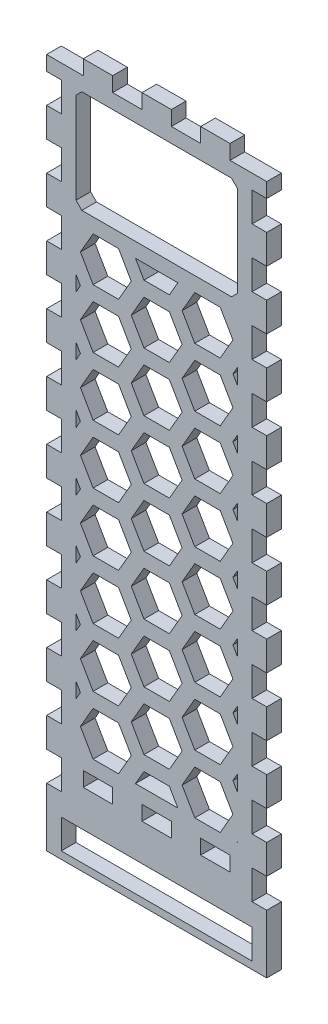
from build123d import *

# Parameters (mm, degrees)
SKETCH1_W           = 95.25
SKETCH1_H           = 304.8
BOSS_EXTRUDE1_DEPTH = 6.35
SKETCH2_W           = 6.35
SKETCH2_H           = 12.7
CUT_EXTRUDE1_DEPTH  = 320.399319035
LPATTERN1_COUNT     = 12
LPATTERN1_PITCH     = 25.4
SKETCH3_W           = 15.875
SKETCH3_H           = 6.35
SKETCH3_W_2         = 12.7
CUT_EXTRUDE2_DEPTH  = 320.399319035
SKETCH4_W           = 12.7
SKETCH4_H           = 6.35
CUT_EXTRUDE3_DEPTH  = 320.399319035
SKETCH7_W           = 6.35
SKETCH7_H           = 12.7
BOSS_EXTRUDE2_DEPTH = 6.35
SKETCH5_W           = 82.55
SKETCH5_H           = 12.7
CUT_EXTRUDE4_DEPTH  = 320.399319035
SKETCH8_W           = 69.85
SKETCH8_H           = 247.65
BOSS_EXTRUDE3_DEPTH = 6.35
CUT_EXTRUDE6_DEPTH  = 320.399319035
FILL_PATTERN1_DEPTH = 6.35
SKETCH8_2_W         = 69.85
SKETCH8_2_H         = 247.65
CUT_EXTRUDE7_DEPTH  = 320.399319035
SKETCH10_W          = 69.85
SKETCH10_H          = 6.35
BOSS_EXTRUDE4_DEPTH = 6.35
SKETCH11_W          = 69.85
SKETCH11_H          = 44.45
CUT_EXTRUDE8_DEPTH  = 320.399319035
CHAMFER1_SIZE       = 2.54


# Read off the part's stored shape, not the designer's step: Fill Pattern1
with BuildPart() as part:
    # Sketch1 → Boss-Extrude1 (new body)
    with BuildSketch(Plane.XY):
        with Locations((47.625, 152.4)):
            Rectangle(SKETCH1_W, SKETCH1_H)
    extrude(amount=BOSS_EXTRUDE1_DEPTH)

    # Sketch2 → Cut-Extrude1 (cut, through all)
    with BuildSketch(Plane.XY.offset(6.35)):
        with Locations((3.175, 6.35)):
            Rectangle(SKETCH2_W, SKETCH2_H)
        with Locations((92.075, 6.35)):
            Rectangle(SKETCH2_W, SKETCH2_H)
    cut_extrude1 = extrude(amount=-CUT_EXTRUDE1_DEPTH, mode=Mode.SUBTRACT)

    # LPattern1: Cut-Extrude1 ×12
    with Locations(*[(0, i * LPATTERN1_PITCH, 0) for i in range(1, LPATTERN1_COUNT)]):
        add(cut_extrude1, mode=Mode.SUBTRACT)

    # Sketch3 → Cut-Extrude2 (cut, through all)
    with BuildSketch(Plane.XY.offset(6.35)):
        with Locations((7.9375, 301.625)):
            Rectangle(SKETCH3_W, SKETCH3_H)
        with Locations((34.925, 301.625)):
            Rectangle(SKETCH3_W_2, SKETCH3_H)
        with Locations((60.325, 301.625)):
            Rectangle(SKETCH3_W_2, SKETCH3_H)
        with Locations((87.3125, 301.625)):
            Rectangle(SKETCH3_W, SKETCH3_H)
    extrude(amount=-CUT_EXTRUDE2_DEPTH, mode=Mode.SUBTRACT)

    # Sketch4 → Cut-Extrude3 (cut, through all)
    with BuildSketch(Plane.XY.offset(6.35)):
        with Locations((22.225, 34.925)):
            Rectangle(SKETCH4_W, SKETCH4_H)
        with Locations((47.625, 34.925)):
            Rectangle(SKETCH4_W, SKETCH4_H)
        with Locations((73.025, 34.925)):
            Rectangle(SKETCH4_W, SKETCH4_H)
    extrude(amount=-CUT_EXTRUDE3_DEPTH, mode=Mode.SUBTRACT)

    # Sketch7 → Boss-Extrude2 (add, through all)
    with BuildSketch(Plane.XY.offset(6.35)):
        with Locations((3.175, 6.35)):
            Rectangle(SKETCH7_W, SKETCH7_H)
        with Locations((92.075, 6.35)):
            Rectangle(SKETCH7_W, SKETCH7_H)
    extrude(amount=-BOSS_EXTRUDE2_DEPTH)

    # Sketch5 → Cut-Extrude4 (cut, through all)
    with BuildSketch(Plane.XY.offset(6.35)):
        with Locations((47.625, 9.525)):
            Rectangle(SKETCH5_W, SKETCH5_H)
    extrude(amount=-CUT_EXTRUDE4_DEPTH, mode=Mode.SUBTRACT)

    # Sketch8<2> → Cut-Extrude7 (cut, through all)
    with BuildSketch(Plane.XY.offset(6.35)):
        with Locations((47.625, 168.275)):
            Rectangle(SKETCH8_2_W, SKETCH8_2_H)
    extrude(amount=-CUT_EXTRUDE7_DEPTH, mode=Mode.SUBTRACT)


with BuildPart() as body_2:
    # Sketch8 → Boss-Extrude3 (new body)
    with BuildSketch(Plane.XY.offset(6.35)):
        with Locations((47.625, 168.275)):
            Rectangle(SKETCH8_W, SKETCH8_H)
    extrude(amount=-BOSS_EXTRUDE3_DEPTH)

    # Sketch9 → Cut-Extrude6 (cut, through all)
    with BuildSketch(Plane(origin=(0, 0, 0), x_dir=(-1, 0, 0), z_dir=(0, 0, -1))):
        Polygon((-42.125738686, 279.4), (-53.124261314, 279.4), (-58.623522628, 269.875), (-53.124261314, 260.35), (-42.125738686, 260.35), (-36.626477372, 269.875), align=None)
    extrude(amount=-CUT_EXTRUDE6_DEPTH, mode=Mode.SUBTRACT)

    # Fill Pattern1 outline → Fill Pattern1 (cut)
    with BuildSketch(Plane.XY):
        Polygon((31.127216058, 241.3), (20.12869343, 241.3), (14.629432116, 231.775), (20.12869343, 222.25), (31.127216058, 222.25), (36.626477372, 231.775), align=None)
        Polygon((64.122783942, 241.3), (58.623522628, 231.775), (64.122783942, 222.25), (75.12130657, 222.25), (80.620567884, 231.775), (75.12130657, 241.3), align=None)
        Polygon((82.55, 197.016874454), (80.620567884, 193.675), (82.55, 190.333125546), align=None)
        Polygon((82.55, 164.933125546), (82.55, 171.616874454), (80.620567884, 168.275), align=None)
        Polygon((80.620567884, 219.075), (82.55, 215.733125546), (82.55, 222.416874454), align=None)
        Polygon((82.55, 139.533125546), (82.55, 146.216874454), (80.620567884, 142.875), align=None)
        Polygon((80.620567884, 244.475), (82.55, 241.133125546), (82.55, 247.816874454), align=None)
        Polygon((82.55, 114.133125546), (82.55, 120.816874454), (80.620567884, 117.475), align=None)
        Polygon((80.620567884, 269.875), (82.55, 266.533125546), (82.55, 273.216874454), align=None)
        Polygon((82.55, 88.733125546), (82.55, 95.416874454), (80.620567884, 92.075), align=None)
        Polygon((82.453654989, 292.1), (82.55, 291.933125546), (82.55, 292.1), align=None)
        Polygon((82.55, 63.333125546), (82.55, 70.016874454), (80.620567884, 66.675), align=None)
        Polygon((80.620567884, 282.575), (75.12130657, 292.1), (64.122783942, 292.1), (58.623522628, 282.575), (64.122783942, 273.05), (75.12130657, 273.05), align=None)
        Polygon((82.55, 44.45), (82.55, 44.616874454), (82.453654989, 44.45), align=None)
        Polygon((53.124261314, 285.75), (56.790435523, 292.1), (38.459564477, 292.1), (42.125738686, 285.75), align=None)
        Polygon((64.122783942, 44.45), (75.12130657, 44.45), (80.620567884, 53.975), (75.12130657, 63.5), (64.122783942, 63.5), (58.623522628, 53.975), align=None)
        Polygon((36.626477372, 282.575), (31.127216058, 292.1), (20.12869343, 292.1), (14.629432116, 282.575), (20.12869343, 273.05), (31.127216058, 273.05), align=None)
        Polygon((38.459564477, 44.45), (56.790435523, 44.45), (53.124261314, 50.8), (42.125738686, 50.8), align=None)
        Polygon((12.7, 291.933125546), (12.796345011, 292.1), (12.7, 292.1), align=None)
        Polygon((20.12869343, 44.45), (31.127216058, 44.45), (36.626477372, 53.975), (31.127216058, 63.5), (20.12869343, 63.5), (14.629432116, 53.975), align=None)
        Polygon((14.629432116, 269.875), (12.7, 273.216874454), (12.7, 266.533125546), align=None)
        Polygon((14.629432116, 244.475), (12.7, 247.816874454), (12.7, 241.133125546), align=None)
        Polygon((12.7, 70.016874454), (12.7, 63.333125546), (14.629432116, 66.675), align=None)
        Polygon((14.629432116, 219.075), (12.7, 222.416874454), (12.7, 215.733125546), align=None)
        Polygon((12.7, 95.416874454), (12.7, 88.733125546), (14.629432116, 92.075), align=None)
        Polygon((14.629432116, 193.675), (12.7, 197.016874454), (12.7, 190.333125546), align=None)
        Polygon((12.7, 120.816874454), (12.7, 114.133125546), (14.629432116, 117.475), align=None)
        Polygon((14.629432116, 168.275), (12.7, 171.616874454), (12.7, 164.933125546), align=None)
        Polygon((12.7, 146.216874454), (12.7, 139.533125546), (14.629432116, 142.875), align=None)
        Polygon((64.122783942, 266.7), (58.623522628, 257.175), (64.122783942, 247.65), (75.12130657, 247.65), (80.620567884, 257.175), (75.12130657, 266.7), align=None)
        Polygon((20.12869343, 247.65), (31.127216058, 247.65), (36.626477372, 257.175), (31.127216058, 266.7), (20.12869343, 266.7), (14.629432116, 257.175), align=None)
        Polygon((53.124261314, 254), (42.125738686, 254), (36.626477372, 244.475), (42.125738686, 234.95), (53.124261314, 234.95), (58.623522628, 244.475), align=None)
        Polygon((31.127216058, 215.9), (20.12869343, 215.9), (14.629432116, 206.375), (20.12869343, 196.85), (31.127216058, 196.85), (36.626477372, 206.375), align=None)
        Polygon((53.124261314, 203.2), (42.125738686, 203.2), (36.626477372, 193.675), (42.125738686, 184.15), (53.124261314, 184.15), (58.623522628, 193.675), align=None)
        Polygon((31.127216058, 165.1), (20.12869343, 165.1), (14.629432116, 155.575), (20.12869343, 146.05), (31.127216058, 146.05), (36.626477372, 155.575), align=None)
        Polygon((64.122783942, 215.9), (58.623522628, 206.375), (64.122783942, 196.85), (75.12130657, 196.85), (80.620567884, 206.375), (75.12130657, 215.9), align=None)
        Polygon((53.124261314, 228.6), (42.125738686, 228.6), (36.626477372, 219.075), (42.125738686, 209.55), (53.124261314, 209.55), (58.623522628, 219.075), align=None)
        Polygon((31.127216058, 190.5), (20.12869343, 190.5), (14.629432116, 180.975), (20.12869343, 171.45), (31.127216058, 171.45), (36.626477372, 180.975), align=None)
        Polygon((53.124261314, 177.8), (42.125738686, 177.8), (36.626477372, 168.275), (42.125738686, 158.75), (53.124261314, 158.75), (58.623522628, 168.275), align=None)
        Polygon((31.127216058, 139.7), (20.12869343, 139.7), (14.629432116, 130.175), (20.12869343, 120.65), (31.127216058, 120.65), (36.626477372, 130.175), align=None)
        Polygon((75.12130657, 146.05), (80.620567884, 155.575), (75.12130657, 165.1), (64.122783942, 165.1), (58.623522628, 155.575), (64.122783942, 146.05), align=None)
        Polygon((64.122783942, 190.5), (58.623522628, 180.975), (64.122783942, 171.45), (75.12130657, 171.45), (80.620567884, 180.975), (75.12130657, 190.5), align=None)
        Polygon((53.124261314, 152.4), (42.125738686, 152.4), (36.626477372, 142.875), (42.125738686, 133.35), (53.124261314, 133.35), (58.623522628, 142.875), align=None)
        Polygon((31.127216058, 114.3), (20.12869343, 114.3), (14.629432116, 104.775), (20.12869343, 95.25), (31.127216058, 95.25), (36.626477372, 104.775), align=None)
        Polygon((75.12130657, 120.65), (80.620567884, 130.175), (75.12130657, 139.7), (64.122783942, 139.7), (58.623522628, 130.175), (64.122783942, 120.65), align=None)
        Polygon((53.124261314, 127), (42.125738686, 127), (36.626477372, 117.475), (42.125738686, 107.95), (53.124261314, 107.95), (58.623522628, 117.475), align=None)
        Polygon((31.127216058, 88.9), (20.12869343, 88.9), (14.629432116, 79.375), (20.12869343, 69.85), (31.127216058, 69.85), (36.626477372, 79.375), align=None)
        Polygon((75.12130657, 95.25), (80.620567884, 104.775), (75.12130657, 114.3), (64.122783942, 114.3), (58.623522628, 104.775), (64.122783942, 95.25), align=None)
        Polygon((53.124261314, 101.6), (42.125738686, 101.6), (36.626477372, 92.075), (42.125738686, 82.55), (53.124261314, 82.55), (58.623522628, 92.075), align=None)
        Polygon((75.12130657, 69.85), (80.620567884, 79.375), (75.12130657, 88.9), (64.122783942, 88.9), (58.623522628, 79.375), (64.122783942, 69.85), align=None)
        Polygon((53.124261314, 76.2), (42.125738686, 76.2), (36.626477372, 66.675), (42.125738686, 57.15), (53.124261314, 57.15), (58.623522628, 66.675), align=None)
    extrude(amount=FILL_PATTERN1_DEPTH, mode=Mode.SUBTRACT)

    # Combine1: union part
    add(part.part)

    # Sketch10 → Boss-Extrude4 (add, through all)
    with BuildSketch(Plane(origin=(0, 0, 0), x_dir=(-1, 0, 0), z_dir=(0, 0, -1))):
        with Locations((-47.625, 244.475)):
            Rectangle(SKETCH10_W, SKETCH10_H)
    extrude(amount=-BOSS_EXTRUDE4_DEPTH)

    # Sketch11 → Cut-Extrude8 (cut, through all)
    with BuildSketch(Plane(origin=(0, 0, 0), x_dir=(-1, 0, 0), z_dir=(0, 0, -1))):
        with Locations((-47.625, 269.875)):
            Rectangle(SKETCH11_W, SKETCH11_H)
    extrude(amount=-CUT_EXTRUDE8_DEPTH, mode=Mode.SUBTRACT)

    # Chamfer1
    chamfer1_edges = [body_2.edges().sort_by_distance(p)[0] for p in [
        (82.55, 292.1, 3.175),
        (12.7, 292.1, 3.175),
        (82.55, 247.65, 3.175),
        (12.7, 247.65, 3.175),
    ]]
    chamfer(chamfer1_edges, length=CHAMFER1_SIZE)


solid = body_2.part
